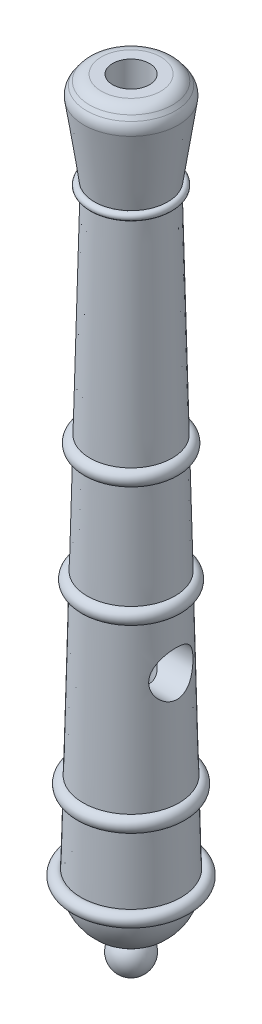
from build123d import *

# Parameters (mm, degrees)
SKETCH1_R           = 8.636
BOSS_EXTRUDE1_DEPTH = 51.689
DRAFT3_ANGLE        = -1.34
CHAMFER1_SIZE       = 2.54
CHAMFER1_SIZE2      = 2.23950947
FILLET1_R           = 2.54
FILLET2_R           = 2.54
SKETCH12_R          = 3.175
CUT_EXTRUDE1_DEPTH  = 119.888
SKETCH18_R          = 1.27
SKETCH20_R          = 1.27
SKETCH22_R          = 1.27
SKETCH23_R          = 3.81
CUT_EXTRUDE2_DEPTH  = 9.525


with BuildPart() as part:
    # Sketch1 → Boss-Extrude1 (new, symmetric)
    with BuildSketch(Plane(origin=(0, 0, 0), x_dir=(1, 0, 0), z_dir=(0, 1, 0))):
        with Locations(Location((0, 0, 0), (0, 0, 270))):
            Circle(SKETCH1_R)
    extrude(amount=BOSS_EXTRUDE1_DEPTH, both=True)

    # Draft3
    draft3_faces = [part.faces().sort_by_distance(p)[0] for p in [
        (0, 0, -8.636),
    ]]
    draft(draft3_faces, Plane(origin=(0, -51.689, 0), x_dir=(0, 0, -1), z_dir=(0, -1, 0)), DRAFT3_ANGLE)

    # Sketch5 → Revolve9 (revolve)
    with BuildSketch(Plane.XZ.offset(51.689)):
        with BuildLine():
            Line((3.13563785, 8.046631051), (-3.13563785, -8.046631051))
            ThreePointArc((-3.13563785, -8.046631051), (-8.046631051, 3.13563785), (3.13563785, 8.046631051))
        make_face()
    revolve(axis=Axis((3.13563785, -51.689, 8.046631051), (-0.36308914433055645, 0, -0.931754406090631)))

    # Sketch7 → Revolve10 (revolve)
    with BuildSketch(Plane(origin=(0, 0, 0), x_dir=(0, 0, -1), z_dir=(1, 0, 0)), mode=Mode.PRIVATE) as revolve10_sk:
        with BuildLine():
            Line((0, -65.855173364), (0, -60.322481787))
            ThreePointArc((0, -60.322481787), (-1.010841654, -60.263737063), (-2.008073552, -60.088293816))
            ThreePointArc((-2.008073552, -60.088293816), (-3.053246596, -63.685284829), (0, -65.855173364))
        make_face()
    revolve(revolve10_sk.sketch.rotate(Axis((0, -65.855173364, 0), (0, 1, 0)), 180), axis=Axis((0, -65.855173364, 0), (0, 1, 0)))

    # Sketch11 → Revolve11 (revolve)
    with BuildSketch(Plane(origin=(0, 0, 0), x_dir=(0, 0, -1), z_dir=(1, 0, 0))):
        Polygon((0, 51.689), (-6.217815216, 51.689), (-8.632249768, 68.199), (0, 68.199), align=None)
    revolve(axis=Axis((0, 68.199, 0), (0, -1, 0)))

    # Chamfer1
    chamfer1_edges = [part.edges().sort_by_distance(p)[0] for p in [
        (0, 68.199, -8.632249768),
    ]]
    chamfer1_side = [part.faces().sort_by_distance(p)[0] for p in [
        (0, 59.944, -7.425032492),
    ]]
    chamfer(chamfer1_edges, length=CHAMFER1_SIZE, length2=CHAMFER1_SIZE2, reference=chamfer1_side[0])

    # Fillet1
    fillet1_edges = [part.edges().sort_by_distance(p)[0] for p in [
        (0, 65.685732639, -8.264707699),
    ]]
    fillet(fillet1_edges, radius=FILLET1_R)

    # Fillet2
    fillet2_edges = [part.edges().sort_by_distance(p)[0] for p in [
        (0, 68.199, -6.392740298),
    ]]
    fillet(fillet2_edges, radius=FILLET2_R)

    # Sketch12 → Cut-Extrude1 (cut)
    with BuildSketch(Plane(origin=(0, 68.199, 0), x_dir=(1, 0, 0), z_dir=(0, 1, 0))):
        with Locations(Location((0, 0, 0), (0, 0, 270))):
            Circle(SKETCH12_R)
    extrude(amount=-CUT_EXTRUDE1_DEPTH, mode=Mode.SUBTRACT)

    # Sweep1: read off the stored shape, not the designer's step
    # Sweep1 outline → Sweep1 (revolve)
    with BuildSketch(Plane.XY):
        with BuildLine():
            Line((6.231046286, 52.286704822), (6.231046286, 51.123368464))
            ThreePointArc((6.231046286, 51.123368464), (7.153352427, 51.648592605), (6.305224009, 52.286704822))
            Line((6.305224009, 52.286704822), (6.231046286, 52.286704822))
        make_face()
    revolve(axis=Axis((0, 0, 0), (0, 1, 0)))

    # Sweep1 2 outline → Sweep1 2 (revolve)
    with BuildSketch(Plane.XY):
        Polygon((6.231046286, 51.779474584), (6.217815216, 51.689), (6.231046286, 51.123368464), align=None)
    revolve(axis=Axis((0, 0, 0), (0, 1, 0)))

    # Sweep2: read off the stored shape, not the designer's step
    # Sweep2 outline → Sweep2 (revolve)
    with BuildSketch(Plane.XY):
        with BuildLine():
            Line((8.602736104, -50.266960192), (8.602736104, -52.308965788))
            Line((8.602736104, -52.308965788), (8.613718037, -52.308965788))
            ThreePointArc((8.613718037, -52.308965788), (10.264985299, -51.279052922), (8.602736104, -50.266960192))
        make_face()
    revolve(axis=Axis((0, 0, 0), (0, 1, 0)))

    # Sweep3: sweep along a path in Sketch16
    with BuildLine(Plane(origin=(0, -37.592, 0), x_dir=(1, 0, 0), z_dir=(0, 1, 0))) as sweep3_path:
        CenterArc((0, 0), 8.3693, 0, 360)
    # Sketch18 → Sweep3 (sweep)
    with BuildSketch(Plane(origin=(0, 0, 0), x_dir=(0, 0, -1), z_dir=(1, 0, 0))):
        with Locations((8.306247529, -37.592)):
            Circle(SKETCH18_R)
    sweep(path=sweep3_path.line)

    # Sweep4: sweep along a path in Sketch19
    with BuildLine(Plane(origin=(0, -7.112, 0), x_dir=(1, 0, 0), z_dir=(0, 1, 0))) as sweep4_path:
        CenterArc((0, 0), 7.5692, 0, 360)
    # Sketch20 → Sweep4 (sweep)
    with BuildSketch(Plane(origin=(0, 0, 0), x_dir=(0, 0, -1), z_dir=(1, 0, 0))):
        with Locations((7.5692, -7.112)):
            Circle(SKETCH20_R)
    sweep(path=sweep4_path.line)

    # Sweep5: sweep along a path in Sketch21
    with BuildLine(Plane(origin=(0, 13.208, 0), x_dir=(1, 0, 0), z_dir=(0, 1, 0))) as sweep5_path:
        CenterArc((0, 0), 7.112, 0, 360)
    # Sketch22 → Sweep5 (sweep)
    with BuildSketch(Plane(origin=(0, 0, 0), x_dir=(0, 0, -1), z_dir=(1, 0, 0))):
        with Locations((7.106236422, 13.208)):
            Circle(SKETCH22_R)
    sweep(path=sweep5_path.line)

    # Sketch23 → Cut-Extrude2 (cut, symmetric)
    with BuildSketch(Plane(origin=(0, 0, 0), x_dir=(0, 0, -1), z_dir=(1, 0, 0))):
        with Locations(Location((0, -17.270862063, 0), (0, 0, 304.923797653))):
            Circle(SKETCH23_R)
    extrude(amount=CUT_EXTRUDE2_DEPTH, both=True, mode=Mode.SUBTRACT)


solid = part.part
